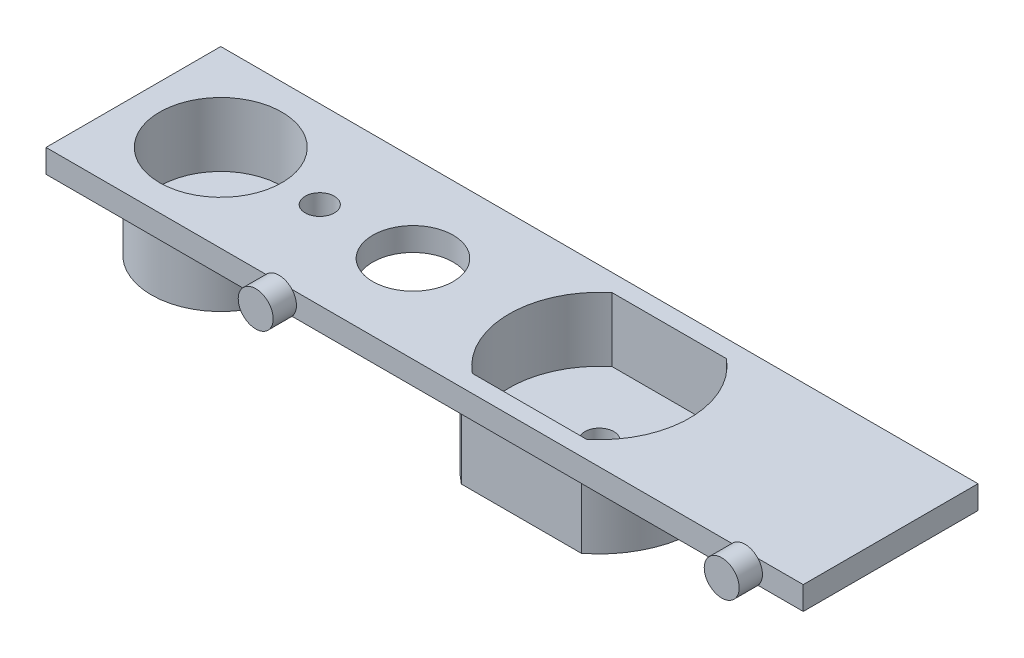
from build123d import *

# Parameters (mm, degrees)
SKETCH_1_W            = 65
SKETCH_1_H            = 15
EXTRUDE_1_DEPTH       = 2
SKETCH_2_R            = 1.25
SKETCH_2_R_2          = 3.45
SKETCH_2_R_3          = 1.5
CUT_EXTRUDE_1_DEPTH   = 2
SKETCH_4_R            = 1.5
EXTRUDE_2_DEPTH       = 2
SKETCH_5_R            = 5.95
SKETCH_5_R_2          = 5.25
EXTRUDE_3_DEPTH       = 8
EXTRUDE_START         = -8
EXTRUDE_4_OUTLINE_R   = 5.25
EXTRUDE_4_OUTLINE_R_2 = 1.25
EXTRUDE_4_DEPTH       = 8
CUT_EXTRUDE_START     = -5.5
SKETCH_5_11_R         = 5.25
SKETCH_5_11_R_2       = 1.5
SKETCH_5_11_R_3       = 1.25
CUT_EXTRUDE_2_DEPTH   = 5.5
CUT_EXTRUDE_START_2   = -8
SKETCH_5_12_R         = 1.5
CUT_EXTRUDE_3_DEPTH   = 8


# Read off the part's stored shape, not the designer's step: 凸台-拉伸4
with BuildPart() as part:
    # 草图1 → 凸台-拉伸1 (new body)
    with BuildSketch(Plane(origin=(0, 0, 0), x_dir=(1, 0, 0), z_dir=(0, 1, 0))):
        with Locations((-7.5, 0)):
            Rectangle(SKETCH_1_W, SKETCH_1_H)
    extrude(amount=EXTRUDE_1_DEPTH)

    # 草图2 → 切除-拉伸1 (cut)
    with BuildSketch(Plane(origin=(0, 0, 0), x_dir=(1, 0, 0), z_dir=(0, 1, 0))):
        with Locations(Location((0, 0, 0), (0, 0, 270))):
            Circle(SKETCH_2_R)
        with Locations(Location((-16, 0, 0), (0, 0, 90))):
            Circle(SKETCH_2_R_2)
        with Locations(Location((-24, 0, 0), (0, 0, 90))):
            Circle(SKETCH_2_R)
        with Locations(Location((-32.5, 0, 0), (0, 0, 270))):
            Circle(SKETCH_2_R_3)
    extrude(amount=CUT_EXTRUDE_1_DEPTH, mode=Mode.SUBTRACT)

    # 草图4 → 凸台-拉伸2 (add)
    with BuildSketch(Plane.XY.offset(7.5)):
        with Locations(Location((20, 1, 0), (0, 0, 221.810314896))):
            Circle(SKETCH_4_R)
        with Locations(Location((-20, 1, 0), (0, 0, 221.810314896))):
            Circle(SKETCH_4_R)
    extrude(amount=EXTRUDE_2_DEPTH)

    # 草图5 → 凸台-拉伸3 (add)
    # profile 1 of 2: a face of its own
    with BuildSketch(Plane(origin=(0, 2, 0), x_dir=(1, 0, 0), z_dir=(0, 1, 0))):
        with Locations(Location((-32.5, 0, 0), (0, 0, 270))):
            Circle(SKETCH_5_R)
        with Locations(Location((-32.5, 0, 0), (0, 0, 270))):
            Circle(SKETCH_5_R_2, mode=Mode.SUBTRACT)
    # profile 2 of 2: a face of its own
    with BuildSketch(Plane(origin=(0, 2, 0), x_dir=(1, 0, 0), z_dir=(0, 1, 0))):
        with BuildLine():
            Line((5.149029035, -6.7), (-5.149029035, -6.7))
            ThreePointArc((-5.149029035, -6.7), (-8.45, 0), (-5.149029035, 6.7))
            Line((-5.149029035, 6.7), (5.149029035, 6.7))
            ThreePointArc((5.149029035, 6.7), (8.45, 0), (5.149029035, -6.7))
        make_face()
        with BuildLine():
            ThreePointArc((4.905354218, -6), (7.75, 0), (4.905354218, 6))
            Line((4.905354218, 6), (-4.905354218, 6))
            ThreePointArc((-4.905354218, 6), (-7.75, 0), (-4.905354218, -6))
            Line((-4.905354218, -6), (4.905354218, -6))
        make_face(mode=Mode.SUBTRACT)
    extrude(amount=-EXTRUDE_3_DEPTH)

    # 凸台-拉伸4 outline → 凸台-拉伸4 (add)
    # profile 1 of 2: a face of its own
    with BuildSketch(Plane(origin=(0, 2, 0), x_dir=(1, 0, 0), z_dir=(0, 1, 0)).offset(EXTRUDE_START)):
        with Locations((-32.5, 0)):
            Circle(EXTRUDE_4_OUTLINE_R)
    # profile 2 of 2: a face of its own
    with BuildSketch(Plane(origin=(0, 2, 0), x_dir=(1, 0, 0), z_dir=(0, 1, 0)).offset(EXTRUDE_START)):
        with BuildLine():
            Line((-4.905354218, -6), (4.905354218, -6))
            ThreePointArc((4.905354218, -6), (7.75, 0), (4.905354218, 6))
            Line((4.905354218, 6), (-4.905354218, 6))
            ThreePointArc((-4.905354218, 6), (-7.75, 0), (-4.905354218, -6))
        make_face()
        Circle(EXTRUDE_4_OUTLINE_R_2, mode=Mode.SUBTRACT)
    extrude(amount=EXTRUDE_4_DEPTH)

    # 草图5<11> → 切除-拉伸2 (cut)
    # profile 1 of 2: a face of its own
    with BuildSketch(Plane(origin=(0, 2, 0), x_dir=(1, 0, 0), z_dir=(0, 1, 0)).offset(CUT_EXTRUDE_START)):
        with Locations(Location((-32.5, 0, 0), (0, 0, 270))):
            Circle(SKETCH_5_11_R)
        with Locations(Location((-32.5, 0, 0), (0, 0, 270))):
            Circle(SKETCH_5_11_R_2, mode=Mode.SUBTRACT)
    # profile 2 of 2: a face of its own
    with BuildSketch(Plane(origin=(0, 2, 0), x_dir=(1, 0, 0), z_dir=(0, 1, 0)).offset(CUT_EXTRUDE_START)):
        with BuildLine():
            Line((4.905354218, -6), (-4.905354218, -6))
            ThreePointArc((-4.905354218, -6), (-7.75, 0), (-4.905354218, 6))
            Line((-4.905354218, 6), (4.905354218, 6))
            ThreePointArc((4.905354218, 6), (7.75, 0), (4.905354218, -6))
        make_face()
        with Locations(Location((0, 0, 0), (0, 0, 270))):
            Circle(SKETCH_5_11_R_3, mode=Mode.SUBTRACT)
    extrude(amount=CUT_EXTRUDE_2_DEPTH, mode=Mode.SUBTRACT)

    # 草图5<12> → 切除-拉伸3 (cut)
    with BuildSketch(Plane(origin=(0, 2, 0), x_dir=(1, 0, 0), z_dir=(0, 1, 0)).offset(CUT_EXTRUDE_START_2)):
        with Locations(Location((-32.5, 0, 0), (0, 0, 270))):
            Circle(SKETCH_5_12_R)
    extrude(amount=CUT_EXTRUDE_3_DEPTH, mode=Mode.SUBTRACT)


solid = part.part
